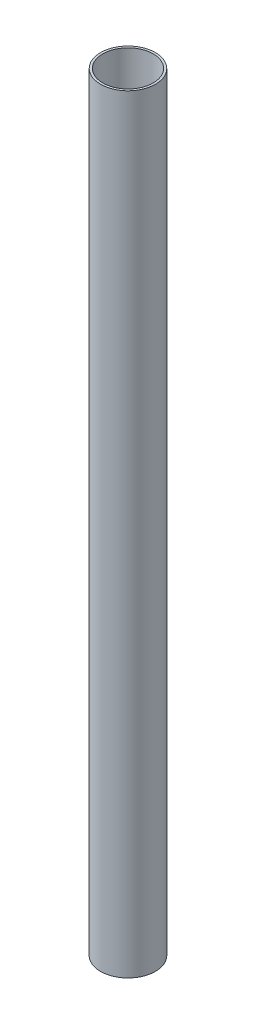
from build123d import *

# Parameters (mm, degrees)
SKETCH_1_R      = 25
SKETCH_1_R_2    = 23
EXTRUDE_1_DEPTH = 700


with BuildPart() as part:
    # Эскиз1 → Бобышка-Вытянуть1 (new body)
    with BuildSketch(Plane(origin=(0, 0, 0), x_dir=(1, 0, 0), z_dir=(0, 1, 0))):
        Circle(SKETCH_1_R)
        Circle(SKETCH_1_R_2, mode=Mode.SUBTRACT)
    extrude(amount=EXTRUDE_1_DEPTH)


solid = part.part
